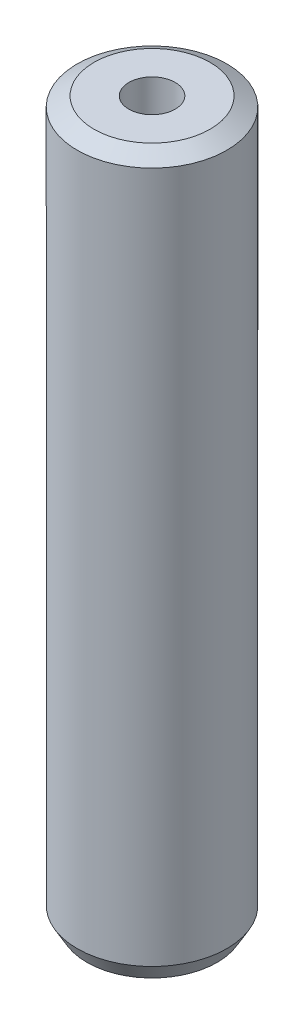
from build123d import *
from OCP.BRepFilletAPI import BRepFilletAPI_MakeChamfer

# Parameters (mm, degrees)
SKETCH1_R           = 37.5
BOSS_EXTRUDE1_DEPTH = 359.790026667
SKETCH2_R           = 11.618983639
CUT_EXTRUDE1_DEPTH  = 364.677554007
CHAMFER1_SIZE       = 4.875052404
CHAMFER1_SIZE2      = 8.443838453


with BuildPart() as part:
    # Sketch1 → Boss-Extrude1 (new body)
    with BuildSketch(Plane(origin=(0, 0, 0), x_dir=(1, 0, 0), z_dir=(0, 1, 0))):
        Circle(SKETCH1_R)
    extrude(amount=BOSS_EXTRUDE1_DEPTH)

    # Sketch2 → Cut-Extrude1 (cut, through all)
    with BuildSketch(Plane(origin=(0, 0, 0), x_dir=(1, 0, 0), z_dir=(0, 1, 0))):
        Circle(SKETCH2_R)
    extrude(amount=CUT_EXTRUDE1_DEPTH, mode=Mode.SUBTRACT)

    # Chamfer1: one chamfer whose edges measure the first distance from different faces: ONE call of the kernel's chamfer builder (chamfer() names one face for all edges)
    chamfer1_edges_1 = [part.edges().sort_by_distance(p)[0] for p in [
        (-37.5, 359.790026667, 0),
    ]]
    chamfer1_side_1 = [part.faces().sort_by_distance(p)[0] for p in [
        (-37.5, 179.895013333, 0),
    ]]
    chamfer1_edges_2 = [part.edges().sort_by_distance(p)[0] for p in [
        (-37.5, 0, 0),
    ]]
    chamfer1_side_2 = [part.faces().sort_by_distance(p)[0] for p in [
        (-36.439339828, 0, 0),
    ]]
    chamfer1 = BRepFilletAPI_MakeChamfer(part.part.solid().wrapped)
    for e in chamfer1_edges_1:
        chamfer1.Add(CHAMFER1_SIZE, CHAMFER1_SIZE2, e.wrapped, chamfer1_side_1[0].wrapped)  # the first distance lies on this face
    for e in chamfer1_edges_2:
        chamfer1.Add(CHAMFER1_SIZE, CHAMFER1_SIZE2, e.wrapped, chamfer1_side_2[0].wrapped)  # the first distance lies on this face
    add(Compound.cast(chamfer1.Shape()), mode=Mode.REPLACE)


solid = part.part
